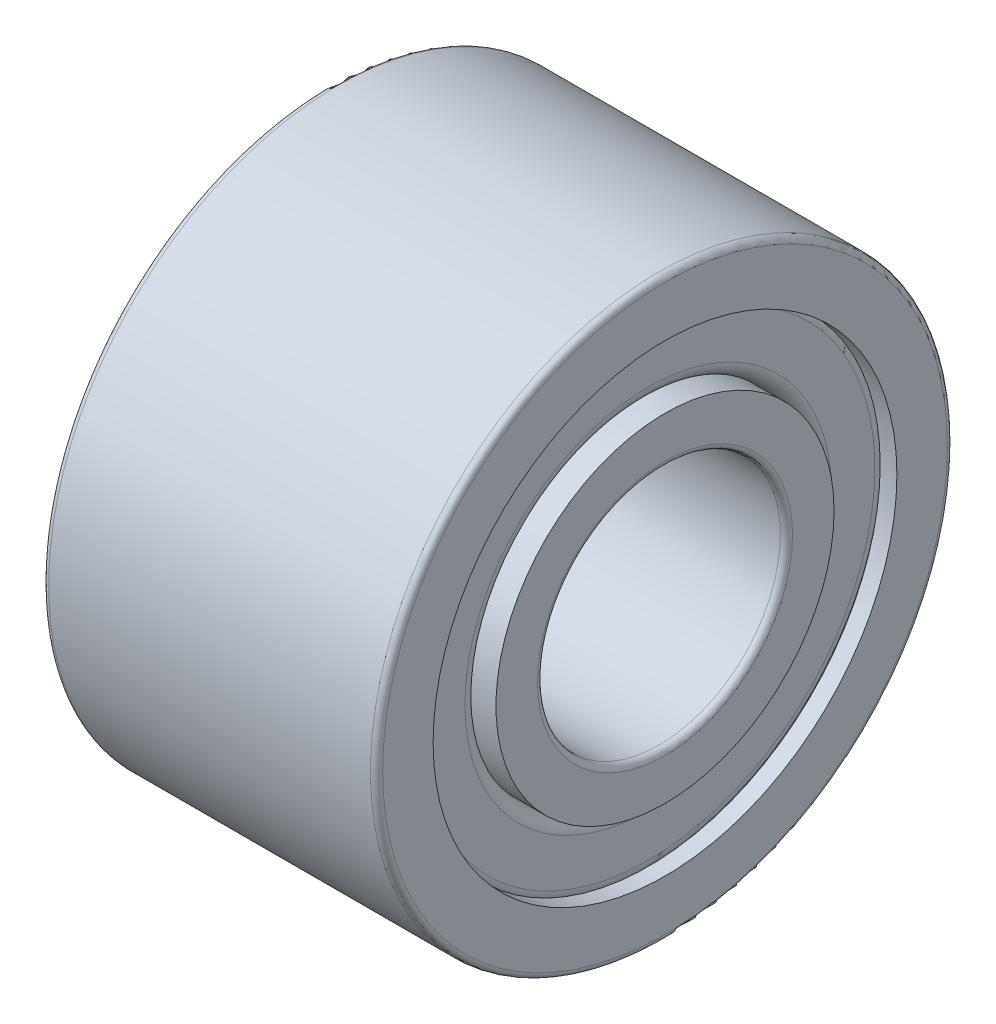
from build123d import *


with BuildPart() as part:
    # OutRacSke → OuterRace (revolve)
    with BuildSketch(Plane.XY):
        with BuildLine():
            Line((-4.95, 7.9325), (-4.95, 7.636875))
            Line((-4.95, 7.636875), (-5.5, 7.636875))
            Line((-5.5, 7.636875), (-5.5, 9.3))
            ThreePointArc((-5.5, 9.3), (-5.441421356, 9.441421356), (-5.3, 9.5))
            Line((-5.3, 9.5), (5.3, 9.5))
            ThreePointArc((5.3, 9.5), (5.441421356, 9.441421356), (5.5, 9.3))
            Line((5.5, 9.3), (5.5, 7.636875))
            Line((5.5, 7.636875), (4.95, 7.636875))
            Line((4.95, 7.636875), (4.95, 7.9325))
            Line((4.95, 7.9325), (-4.95, 7.9325))
        make_face()
    revolve(axis=Axis((-7.9375, 0, 0), (1, 0, 0)))

    # RolSimSke → RollersSimplified (revolve)
    with BuildSketch(Plane(origin=(0, 25.4, 0), x_dir=(1, 0, 0), z_dir=(0, 0, 1))):
        with BuildLine():
            Line((-4.95, -17.9397), (-4.95, -19.3593))
            ThreePointArc((-4.95, -19.3593), (-4.811402929, -19.693902929), (-4.4768, -19.8325))
            Line((-4.4768, -19.8325), (4.4768, -19.8325))
            ThreePointArc((4.4768, -19.8325), (4.811402929, -19.693902929), (4.95, -19.3593))
            Line((4.95, -19.3593), (4.95, -17.9397))
            ThreePointArc((4.95, -17.9397), (4.811402929, -17.605097071), (4.4768, -17.4665))
            Line((4.4768, -17.4665), (-4.4768, -17.4665))
            ThreePointArc((-4.4768, -17.4665), (-4.811402929, -17.605097071), (-4.95, -17.9397))
        make_face()
    revolve(axis=Axis((-25.4, 0, 0), (1, 0, 0)))

    # InsRacSke → InnerRace (revolve)
    with BuildSketch(Plane.XY):
        with BuildLine():
            Line((-5.5, 5.5675), (-5.5, 4.2))
            ThreePointArc((-5.5, 4.2), (-5.441421356, 4.058578644), (-5.3, 4))
            Line((-5.3, 4), (5.3, 4))
            ThreePointArc((5.3, 4), (5.441421356, 4.058578644), (5.5, 4.2))
            Line((5.5, 4.2), (5.5, 5.5675))
            Line((5.5, 5.5675), (-5.5, 5.5675))
        make_face()
    revolve(axis=Axis((-7.9375, 0, 0), (1, 0, 0)))


solid = part.part
